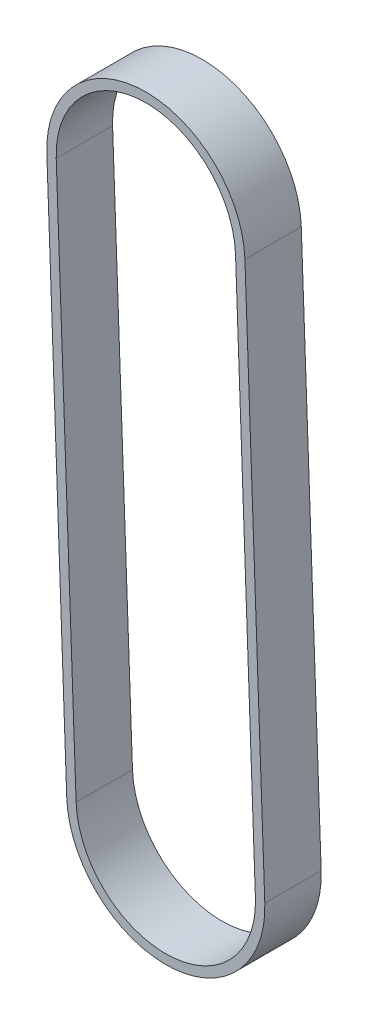
from build123d import *

# Parameters (mm, degrees)
EXTRUDE_THIN1_DEPTH = 9


with BuildPart() as part:
    # Sketch2 → Extrude-Thin1 (new body)
    with BuildSketch(Plane.XY):
        with BuildLine():
            Line((-12.611040877, -88.034452783), (-15.786040877, -0.592076973))
            ThreePointArc((-15.786040877, -0.592076973), (-0.546699905, 15.795630306), (15.841007374, 0.556289334))
            Line((15.841007374, 0.556289334), (19.016007374, -86.886086476))
            ThreePointArc((19.016007374, -86.886086476), (3.776666402, -103.273793755), (-12.611040877, -88.034452783))
        make_face()
        with BuildLine():
            Line((-11.112028692, -87.98002421), (-14.287028692, -0.537648401))
            ThreePointArc((-14.287028692, -0.537648401), (-0.492271333, 14.296618121), (14.341995189, 0.501860761))
            Line((14.341995189, 0.501860761), (17.516995189, -86.940515048))
            ThreePointArc((17.516995189, -86.940515048), (3.722237829, -101.77478157), (-11.112028692, -87.98002421))
        make_face(mode=Mode.SUBTRACT)
    extrude(amount=-EXTRUDE_THIN1_DEPTH)


solid = part.part
